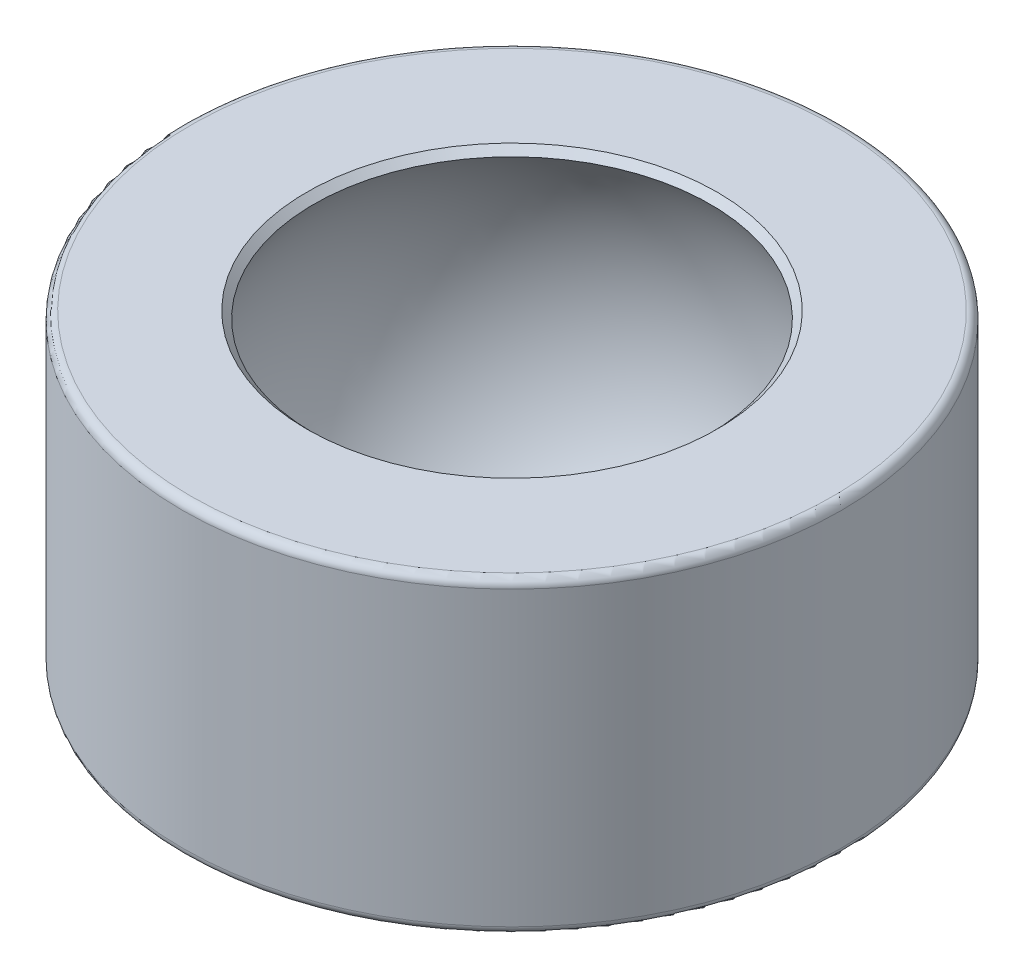
from build123d import *

# Parameters (mm, degrees)
BOSS_EXTRUDE1_DEPTH      = 1.875
BOSS_EXTRUDE1_DEPTH_BACK = 1.875
SKETCH1_R                = 4
SKETCH1_R_2              = 2
FILLET2_R                = 0.1
CHAMFER2_SIZE            = 0.106714114
CHAMFER2_SIZE_2          = 0.15


with BuildPart() as part:
    # Sketch1 → Boss-Extrude1 (new, two sides: drawn at the far end of the back side and taken through both)
    with BuildSketch(Plane(origin=(0, 0, 0), x_dir=(1, 0, 0), z_dir=(0, 1, 0)).offset(-BOSS_EXTRUDE1_DEPTH_BACK)):
        with Locations(Location((0, 0, 0), (0, 0, 270))):
            Circle(SKETCH1_R)
        with Locations(Location((0, 0, 0), (0, 0, 270))):
            Circle(SKETCH1_R_2, mode=Mode.SUBTRACT)
    extrude(amount=BOSS_EXTRUDE1_DEPTH + BOSS_EXTRUDE1_DEPTH_BACK)


with BuildPart() as body_2:
    # Sketch2 → Revolve1 (revolve)
    with BuildSketch(Plane(origin=(0, 0, 0), x_dir=(1, 0, 0), z_dir=(0, 1, 0))):
        with BuildLine():
            Line((0, 3), (0, -3))
            ThreePointArc((0, -3), (-3, 0), (0, 3))
        make_face()
    revolve(axis=Axis((0, 0, -3), (0, 0, 1)))


with BuildPart() as part_1:
    add(part.part)

    # Combine1: cut body 2
    add(body_2.part, mode=Mode.SUBTRACT)

    # Fillet2
    fillet2_edges = [part_1.edges().sort_by_distance(p)[0] for p in [
        (0, -1.875, -4),
        (0, 1.875, -4),
    ]]
    fillet(fillet2_edges, radius=FILLET2_R)

    # Chamfer2
    # the kernel refuses this chamfer: 0.15, 0.106714114 mm, written as the material it takes off along each edge
    with BuildSketch(Plane(origin=(0, -1.875, 0), x_dir=(0, 0, 1), z_dir=(-1, 0, 0))) as chamfer2_piece_1:
        with BuildLine():
            Line((2.435009088, 0.122649938), (2.341874249 + CHAMFER2_SIZE * 1.00000000139, 0))
            Line((2.341874249 + CHAMFER2_SIZE * 1.00000000139, 0), (2.341874249, 0))
            ThreePointArc((2.341874249, 0), (2.390544922, 0.062461731), (2.435009088, 0.122649938))
        make_face()
    revolve(axis=Axis((0, -1.875, 0), (0, 1, 0)), mode=Mode.SUBTRACT)
    with BuildSketch(Plane(origin=(0, 1.875, 0), x_dir=(0, 0, 1), z_dir=(-1, 0, 0))) as chamfer2_piece_2:
        with BuildLine():
            Line((2.341874249 + CHAMFER2_SIZE_2, 0), (2.407214516, -0.084659733))
            ThreePointArc((2.407214516, -0.084659733), (2.375156045, -0.042342432), (2.341874249, 0))
            Line((2.341874249, 0), (2.341874249 + CHAMFER2_SIZE_2, 0))
        make_face()
    revolve(axis=Axis((0, 1.875, 0), (0, 1, 0)), mode=Mode.SUBTRACT)


solid = part_1.part
